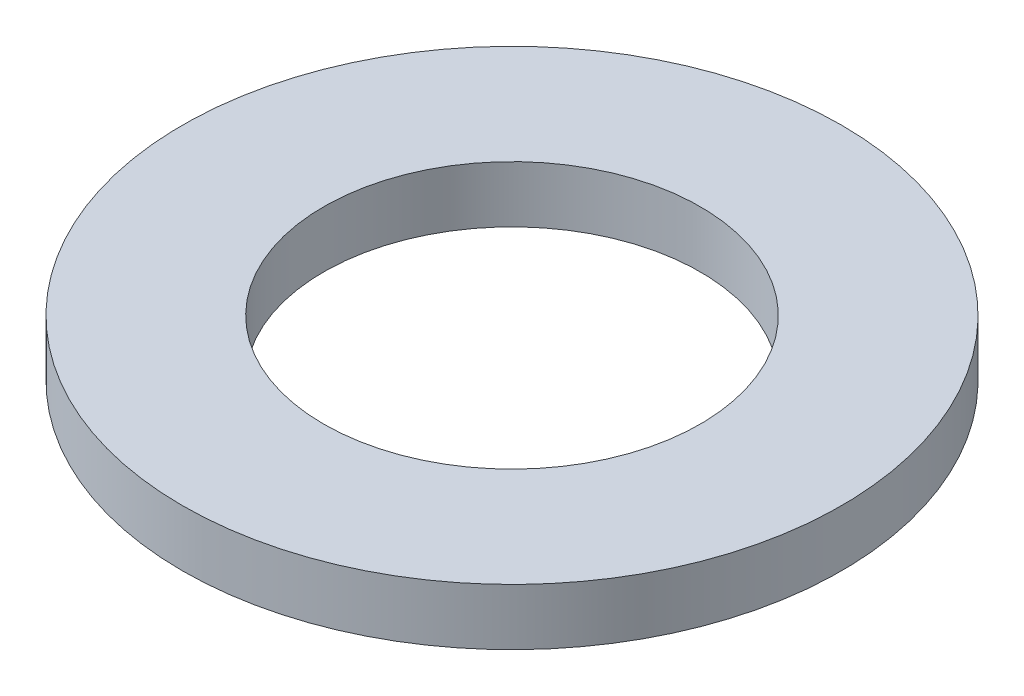
from build123d import *

# Parameters (mm, degrees)
SKETCH1_R           = 35
SKETCH1_R_2         = 20
BOSS_EXTRUDE1_DEPTH = 6


with BuildPart() as part:
    # Sketch1 → Boss-Extrude1 (new body)
    with BuildSketch(Plane(origin=(0, 0, 0), x_dir=(1, 0, 0), z_dir=(0, 1, 0))):
        Circle(SKETCH1_R)
        Circle(SKETCH1_R_2, mode=Mode.SUBTRACT)
    extrude(amount=BOSS_EXTRUDE1_DEPTH)


solid = part.part
